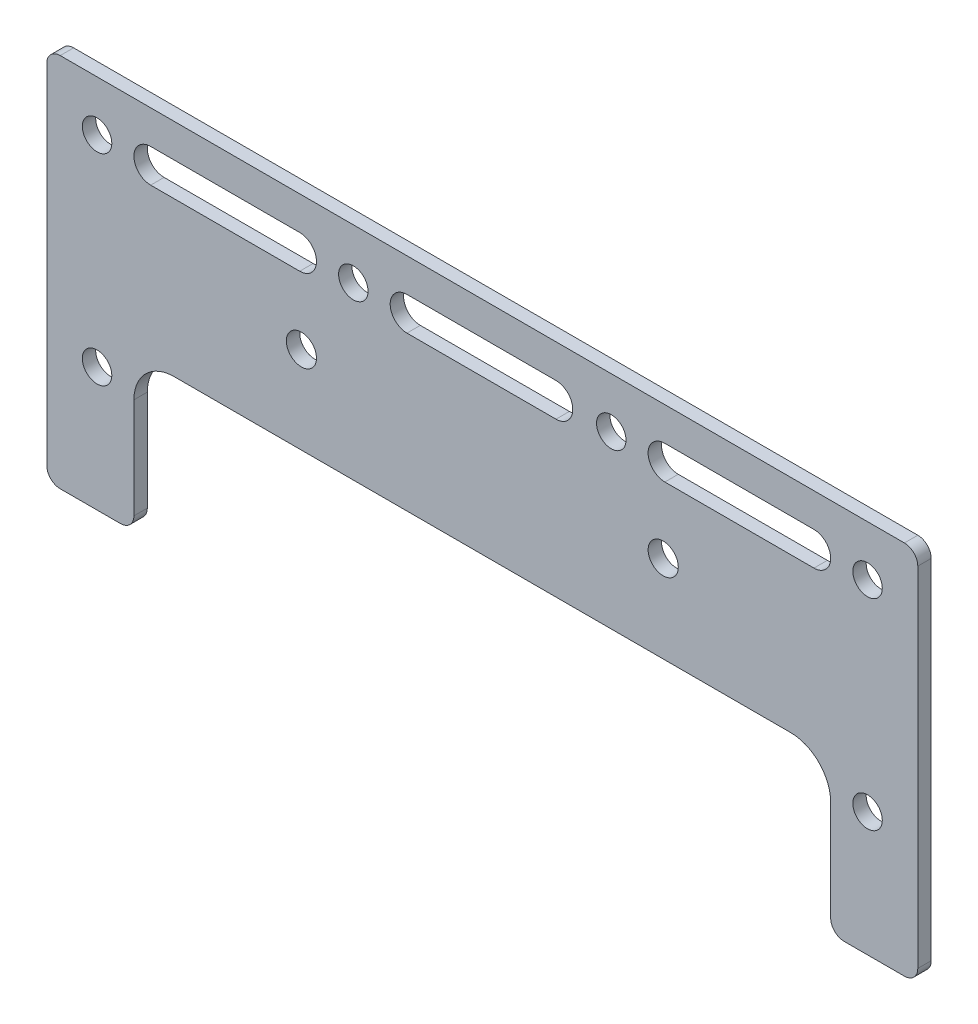
from build123d import *

# Parameters (mm, degrees)
SKETCH_1_R          = 2.2
SKETCH_1_R_2        = 2.25
EXTRUDE_1_DEPTH     = 2
EXTRUDE_START       = -2
EXTRUDE_2_DEPTH     = 2
SKETCH_3_R          = 2.25
CUT_EXTRUDE_1_DEPTH = 23
SKETCH_3_3_R        = 2.25
EXTRUDE_3_DEPTH     = 2
SKETCH_5_W          = 104
SKETCH_5_H          = 6
CUT_EXTRUDE_2_DEPTH = 24
FILLET_1_R          = 6


with BuildPart() as part:
    # 草图1 → 凸台-拉伸1 (new body)
    with BuildSketch(Plane.XY):
        with BuildLine():
            Line((63, 28), (-63, 28))
            ThreePointArc((-63, 28), (-64.414213562, 27.414213562), (-65, 26))
            Line((-65, 26), (-65, -26))
            ThreePointArc((-65, -26), (-64.414213562, -27.414213562), (-63, -28))
            Line((-63, -28), (-54, -28))
            ThreePointArc((-54, -28), (-52.585786438, -27.414213562), (-52, -26))
            Line((-52, -26), (-52, -8))
            ThreePointArc((-52, -8), (-51.414213562, -6.585786438), (-50, -6))
            Line((-50, -6), (50, -6))
            ThreePointArc((50, -6), (51.414213562, -6.585786438), (52, -8))
            Line((52, -8), (52, -26))
            ThreePointArc((52, -26), (52.585786438, -27.414213562), (54, -28))
            Line((54, -28), (63, -28))
            ThreePointArc((63, -28), (64.414213562, -27.414213562), (65, -26))
            Line((65, -26), (65, 26))
            ThreePointArc((65, 26), (64.414213562, 27.414213562), (63, 28))
        make_face()
        with Locations((-57.5, -9.5)):
            Circle(SKETCH_1_R, mode=Mode.SUBTRACT)
        with Locations((-57.5, 20.5)):
            Circle(SKETCH_1_R, mode=Mode.SUBTRACT)
        with Locations((19.25, 20.5)):
            Circle(SKETCH_1_R, mode=Mode.SUBTRACT)
        with Locations((-19.25, 20.5)):
            Circle(SKETCH_1_R, mode=Mode.SUBTRACT)
        with Locations((57.5, 20.5)):
            Circle(SKETCH_1_R, mode=Mode.SUBTRACT)
        with Locations((57.5, -9.5)):
            Circle(SKETCH_1_R, mode=Mode.SUBTRACT)
        with Locations((27, 2.5)):
            Circle(SKETCH_1_R_2, mode=Mode.SUBTRACT)
        with Locations((-27, 2.5)):
            Circle(SKETCH_1_R_2, mode=Mode.SUBTRACT)
        with BuildLine():
            Line((27.25, 18), (49.5, 18))
            ThreePointArc((49.5, 18), (52, 20.5), (49.5, 23))
            Line((49.5, 23), (27.25, 23))
            ThreePointArc((27.25, 23), (24.75, 20.5), (27.25, 18))
        make_face(mode=Mode.SUBTRACT)
        with BuildLine():
            Line((-11.25, 18), (11, 18))
            ThreePointArc((11, 18), (13.5, 20.5), (11, 23))
            Line((11, 23), (-11.25, 23))
            ThreePointArc((-11.25, 23), (-13.75, 20.5), (-11.25, 18))
        make_face(mode=Mode.SUBTRACT)
        with BuildLine():
            Line((-49.5, 18), (-27.25, 18))
            ThreePointArc((-27.25, 18), (-24.75, 20.5), (-27.25, 23))
            Line((-27.25, 23), (-49.5, 23))
            ThreePointArc((-49.5, 23), (-52, 20.5), (-49.5, 18))
        make_face(mode=Mode.SUBTRACT)
    extrude(amount=EXTRUDE_1_DEPTH)

    # 草图2 → 凸台-拉伸2 (add)
    with BuildSketch(Plane.XY.offset(2).offset(EXTRUDE_START)):
        with BuildLine():
            Line((-52, -8), (-52, -11))
            Line((-52, -11), (52, -11))
            Line((52, -11), (52, -8))
            ThreePointArc((52, -8), (51.414213562, -6.585786438), (50, -6))
            Line((50, -6), (-50, -6))
            ThreePointArc((-50, -6), (-51.414213562, -6.585786438), (-52, -8))
        make_face()
    extrude(amount=EXTRUDE_2_DEPTH)

    # 草图3 → 切除-拉伸1 (cut)
    with BuildSketch(Plane.XY.offset(2)):
        with Locations((-27, 8)):
            Circle(SKETCH_3_R)
        with Locations((27, 8)):
            Circle(SKETCH_3_R)
    extrude(amount=-CUT_EXTRUDE_1_DEPTH, mode=Mode.SUBTRACT)

    # 草图3<3> → 凸台-拉伸3 (add)
    with BuildSketch(Plane.XY.offset(2).offset(EXTRUDE_START)):
        with Locations((27, 2.5)):
            Circle(SKETCH_3_3_R)
        with Locations((-27, 2.5)):
            Circle(SKETCH_3_3_R)
    extrude(amount=EXTRUDE_3_DEPTH)

    # 草图5 → 切除-拉伸2 (cut)
    with BuildSketch(Plane.XY.offset(2)):
        with Locations((0, -8)):
            Rectangle(SKETCH_5_W, SKETCH_5_H)
    extrude(amount=-CUT_EXTRUDE_2_DEPTH, mode=Mode.SUBTRACT)

    # 圆角1
    fillet_1_edges = [part.edges().sort_by_distance(p)[0] for p in [
        (52, -5, 1),
        (-52, -5, 1),
    ]]
    fillet(fillet_1_edges, radius=FILLET_1_R)


solid = part.part
